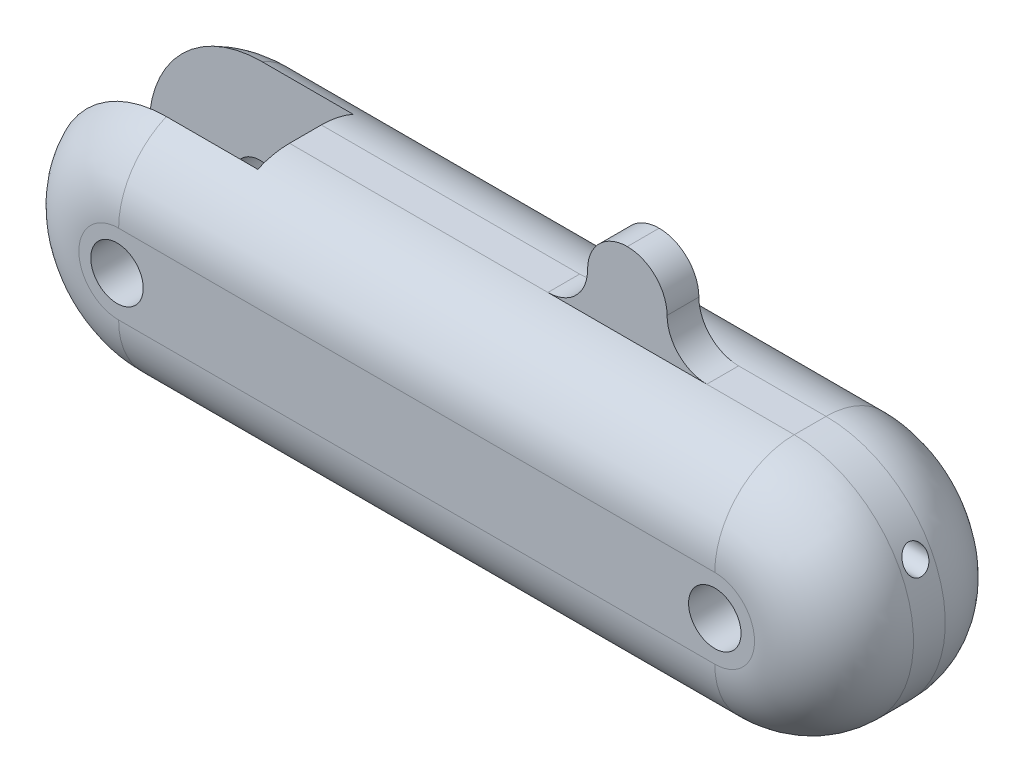
from build123d import *

# Parameters (mm, degrees)
BOSS_EXTRUDE1_DEPTH = 12
FILLET1_R           = 5
SKETCH5_W           = 13.25
SKETCH5_H           = 6
CUT_EXTRUDE3_DEPTH  = 39.184584586
SKETCH6_W           = 5
SKETCH6_H           = 2
BOSS_EXTRUDE2_DEPTH = 5
FILLET2_R           = 2.5
FILLET3_R           = 2.5
SKETCH3_R           = 1.65
CUT_EXTRUDE4_DEPTH  = 33.5278727
SKETCH8_R           = 0.75
CUT_EXTRUDE7_DEPTH  = 56.512113127
SKETCH9_R           = 0.75
CUT_EXTRUDE9_DEPTH  = 26.058827679


with BuildPart() as part:
    # Sketch2 → Boss-Extrude1 (new body)
    with BuildSketch(Plane.XY):
        with BuildLine():
            Line((-18.75, 0), (18.75, 0))
            ThreePointArc((18.75, 0), (26.25, -7.5), (18.75, -15))
            Line((18.75, -15), (-18.75, -15))
            ThreePointArc((-18.75, -15), (-26.25, -7.5), (-18.75, 0))
        make_face()
    extrude(amount=BOSS_EXTRUDE1_DEPTH)

    # Fillet1
    fillet1_edges = [part.edges().sort_by_distance(p)[0] for p in [
        (-26.25, -7.5, 12),
        (0, -15, 12),
        (26.25, -7.5, 12),
        (0, -15, 0),
        (-26.25, -7.5, 0),
        (0, 0, 0),
        (26.25, -7.5, 0),
        (0, 0, 12),
    ]]
    fillet(fillet1_edges, radius=FILLET1_R)

    # Sketch5 → Cut-Extrude3 (cut, through all)
    with BuildSketch(Plane(origin=(0, -25, 0), x_dir=(-1, 0, 0), z_dir=(0, -1, 0))):
        with Locations((19.625, -6)):
            Rectangle(SKETCH5_W, SKETCH5_H)
    extrude(amount=-CUT_EXTRUDE3_DEPTH, mode=Mode.SUBTRACT)

    # Sketch6 → Boss-Extrude2 (add)
    with BuildSketch(Plane(origin=(0, 0, 0), x_dir=(1, 0, 0), z_dir=(0, 1, 0))):
        with Locations((8.25, -6)):
            Rectangle(SKETCH6_W, SKETCH6_H)
    extrude(amount=BOSS_EXTRUDE2_DEPTH)

    # Fillet2
    fillet2_edges = [part.edges().sort_by_distance(p)[0] for p in [
        (10.75, 5, 6),
        (5.75, 5, 6),
    ]]
    fillet(fillet2_edges, radius=FILLET2_R - 0.0001)  # a hair under: the kernel refuses the full size

    # Fillet3
    fillet3_edges = [part.edges().sort_by_distance(p)[0] for p in [
        (5.75, 0, 6),
        (10.75, 0, 6),
    ]]
    fillet(fillet3_edges, radius=FILLET3_R)

    # Sketch3 → Cut-Extrude4 (cut, through all)
    with BuildSketch(Plane.XY.offset(12)):
        with Locations((-18.853477977, -7.5)):
            Circle(SKETCH3_R)
        with Locations((18.75, -7.5)):
            Circle(SKETCH3_R)
    extrude(amount=-CUT_EXTRUDE4_DEPTH, mode=Mode.SUBTRACT)

    # Sketch8 → Cut-Extrude7 (cut, through all)
    with BuildSketch(Plane(origin=(26.25, 0, 0), x_dir=(0, 0, -1), z_dir=(1, 0, 0))):
        with Locations((-6, -4)):
            Circle(SKETCH8_R)
    extrude(amount=-CUT_EXTRUDE7_DEPTH, mode=Mode.SUBTRACT)

    # Sketch9 → Cut-Extrude9 (cut, along a direction that is not the sketch's normal)
    with BuildSketch(Plane.ZY.offset(13)):
        with Locations((6, -11)):
            Circle(SKETCH9_R)
    extrude(amount=-CUT_EXTRUDE9_DEPTH, dir=(-0.988148826849317, 0.15349884688921422, 0), mode=Mode.SUBTRACT)


solid = part.part
